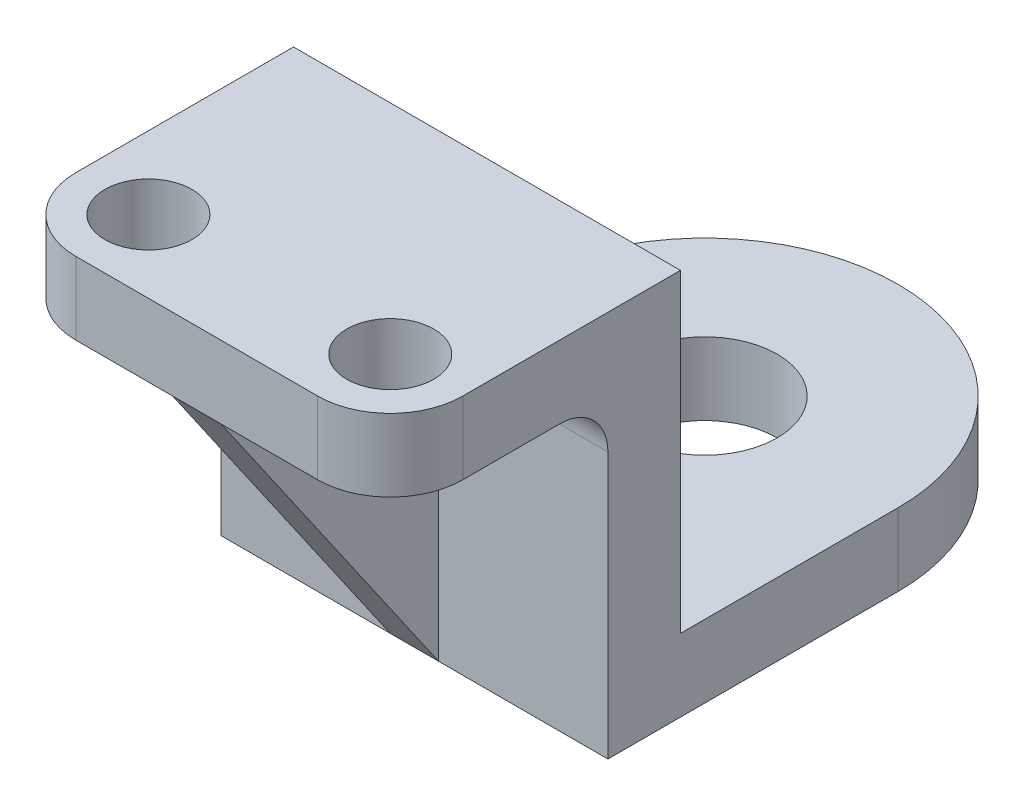
from build123d import *

# Parameters (mm, degrees)
BOSS_EXTRUDE1_DEPTH     = 40
SKETCH2_W               = 15
SKETCH2_H               = 45
BOSS_EXTRUDE2_DEPTH     = 40
FILLET1_R               = 15
SKETCH9_R               = 9
CUT_EXTRUDE1_DEPTH      = 80
FILLET2_R               = 40
CUT_EXTRUDE6_DEPTH      = 171.367250374
CUT_EXTRUDE6_DEPTH_BACK = 171.367250374
SKETCH11_R              = 15
FILLET3_R               = 10
RIB17_REACH             = 172.367
SKETCH14_WALL_W         = 421.791442252
SKETCH14_WALL_H         = 10


with BuildPart() as part:
    # Sketch1 → Boss-Extrude1 (new, symmetric)
    with BuildSketch(Plane.YZ):
        Polygon((-65, 0), (-65, 85), (0, 85), (0, 100), (-80, 100), (-80, 0), align=None)
    extrude(amount=BOSS_EXTRUDE1_DEPTH, both=True)

    # Sketch2 → Boss-Extrude2 (add, symmetric)
    with BuildSketch(Plane.YZ):
        with Locations((-7.5, 122.5)):
            Rectangle(SKETCH2_W, SKETCH2_H)
    extrude(amount=BOSS_EXTRUDE2_DEPTH, both=True)

    # Fillet1
    fillet1_edges = [part.edges().sort_by_distance(p)[0] for p in [
        (-40, -7.5, 145),
        (40, -7.5, 145),
    ]]
    fillet(fillet1_edges, radius=FILLET1_R)

    # Sketch9 → Cut-Extrude1 (cut)
    with BuildSketch(Plane(origin=(0, 0, 0), x_dir=(-1, 0, 0), z_dir=(0, 1, 0))):
        with Locations(Location((25, 130, 0), (0, 0, 90))):
            Circle(SKETCH9_R)
        with Locations(Location((-25, 130, 0), (0, 0, 90))):
            Circle(SKETCH9_R)
    extrude(amount=-CUT_EXTRUDE1_DEPTH, mode=Mode.SUBTRACT)

    # Fillet2
    fillet2_edges = [part.edges().sort_by_distance(p)[0] for p in [
        (-40, -72.5, 0),
        (40, -72.5, 0),
    ]]
    fillet(fillet2_edges, radius=FILLET2_R - 0.0001)  # a hair under: the kernel refuses the full size

    # Sketch11 → Cut-Extrude6 (cut, two sides: drawn at the far end of the back side and taken through both)
    with BuildSketch(Plane.XZ.offset(80).offset(-CUT_EXTRUDE6_DEPTH_BACK)):
        with Locations(Location((0, 40, 0), (0, 0, 270))):
            Circle(SKETCH11_R)
    extrude(amount=CUT_EXTRUDE6_DEPTH + CUT_EXTRUDE6_DEPTH_BACK, mode=Mode.SUBTRACT)

    # Fillet3
    fillet3_edges = [part.edges().sort_by_distance(p)[0] for p in [
        (0, -15, 100),
    ]]
    fillet(fillet3_edges, radius=FILLET3_R)

    # Sketch14 wall → Rib17 (add, up to next)
    with BuildSketch(Plane(origin=(0, -47.5, 122.5), x_dir=(0, -0.822192191644, -0.56920997883), z_dir=(0, 0.56920997883, -0.822192191644)), mode=Mode.PRIVATE) as rib17_sk1:
        Rectangle(SKETCH14_WALL_W, SKETCH14_WALL_H)
    rib17_tool1 = extrude(rib17_sk1.sketch, amount=RIB17_REACH, mode=Mode.PRIVATE) - part.part
    add(rib17_tool1.solids().sort_by_distance((0, -47.5, 122.5))[0])


solid = part.part
